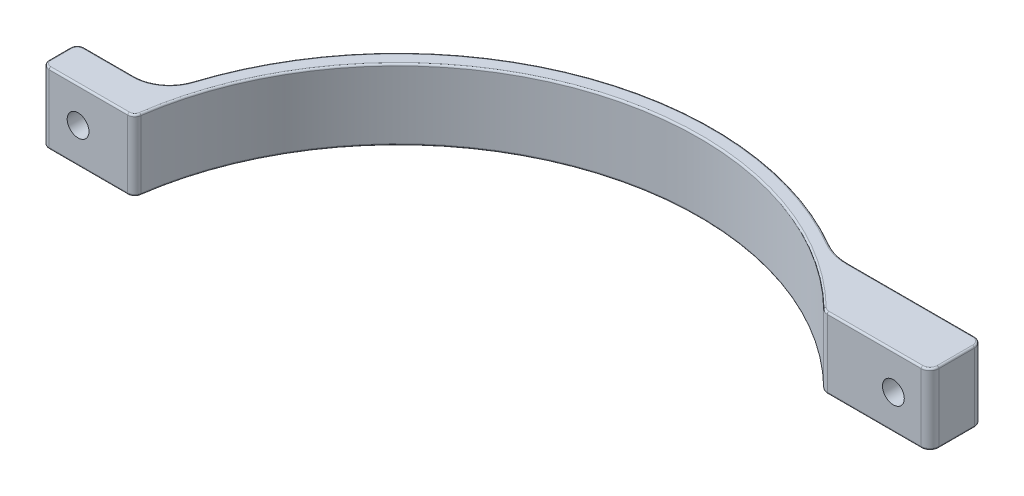
from build123d import *

# Parameters (mm, degrees)
RESSALTO_EXTRUS_O1_DEPTH   = 20
ESBO_O3_R                  = 3.075
CORTE_EXTRUS_O1_DEPTH      = 20
ESBO_O4_R                  = 5.25
CORTE_EXTRUS_O2_DEPTH      = 6
CORTE_EXTRUS_O3_DEPTH      = 138.227202785
CORTE_EXTRUS_O3_DEPTH_BACK = 138.227202785
ESBO_O5_R                  = 3.075
CORTE_EXTRUS_O4_DEPTH      = 5
FILETE1_R                  = 0.5


with BuildPart() as part:
    # Esboço1 → Ressalto-extrusão1 (new body)
    with BuildSketch(Plane(origin=(0, 0, 0), x_dir=(1, 0, 0), z_dir=(0, 1, 0))):
        with BuildLine():
            Line((61.23724357, 60), (87.707972894, 60))
            ThreePointArc((87.707972894, 60), (89.475739847, 60.732233047), (90.207972894, 62.5))
            Line((90.207972894, 62.5), (90.207972894, 72.5))
            ThreePointArc((90.207972894, 72.5), (89.475739847, 74.267766953), (87.707972894, 75))
            Line((87.707972894, 75), (52.115256883, 75))
            ThreePointArc((52.115256883, 75), (48.223697971, 75.513600543), (44.598633294, 77.019230769))
            ThreePointArc((44.598633294, 77.019230769), (-32.102711223, 83.008529273), (-84.815301953, 26.96969697))
            ThreePointArc((-84.815301953, 26.96969697), (-88.441850634, 21.92835115), (-94.345111161, 20))
            Line((-94.345111161, 20), (-108.409715081, 20))
            ThreePointArc((-108.409715081, 20), (-109.823928643, 19.414213562), (-110.409715081, 18))
            Line((-110.409715081, 18), (-110.409715081, 12))
            ThreePointArc((-110.409715081, 12), (-109.823928643, 10.585786438), (-108.409715081, 10))
            Line((-108.409715081, 10), (-86.168439698, 10))
            ThreePointArc((-86.168439698, 10), (-84.855375369, 10.491403941), (-84.187556027, 11.724137931))
            ThreePointArc((-84.187556027, 11.724137931), (-27.432289416, 80.451659382), (59.487608039, 60.714285714))
            ThreePointArc((59.487608039, 60.714285714), (60.292332387, 60.185449751), (61.23724357, 60))
        make_face()
    extrude(amount=RESSALTO_EXTRUS_O1_DEPTH)

    # Esboço3 → Corte-extrusão1 (cut)
    with BuildSketch(Plane.XY.offset(-60)):
        with Locations((79.862425804, 9.799419725)):
            Circle(ESBO_O3_R)
    extrude(amount=-CORTE_EXTRUS_O1_DEPTH, mode=Mode.SUBTRACT)

    # Esboço4 → Corte-extrusão2 (cut)
    with BuildSketch(Plane(origin=(0, 0, -75), x_dir=(-1, 0, 0), z_dir=(0, 0, -1))):
        with Locations((-79.862425804, 9.799419725)):
            Circle(ESBO_O4_R)
    extrude(amount=-CORTE_EXTRUS_O2_DEPTH, mode=Mode.SUBTRACT)

    # Esboço5 → Corte-extrusão3 (cut, two sides: drawn at the far end of the back side and taken through both)
    with BuildSketch(Plane.XY.offset(-10).offset(-CORTE_EXTRUS_O3_DEPTH_BACK)):
        with Locations((-100.179715081, 10)):
            Circle(ESBO_O5_R)
    extrude(amount=CORTE_EXTRUS_O3_DEPTH + CORTE_EXTRUS_O3_DEPTH_BACK, mode=Mode.SUBTRACT)

    # Esboço6 → Corte-extrusão4 (cut)
    with BuildSketch(Plane(origin=(0, 0, -20), x_dir=(-1, 0, 0), z_dir=(0, 0, -1))):
        Polygon((105.204715081, 7.098814897), (105.204715081, 12.901185103), (100.179715081, 15.802370205), (95.154715081, 12.901185103), (95.154715081, 7.098814897), (100.179715081, 4.197629795), align=None)
    extrude(amount=-CORTE_EXTRUS_O4_DEPTH, mode=Mode.SUBTRACT)

    # Filete1
    filete1_edges = [part.edges().sort_by_distance(p)[0] for p in [
        (-32.102711223, 0, -83.008529273),
        (-88.441850634, 0, -21.92835115),
        (-101.377413121, 0, -20),
        (-109.823928643, 0, -19.414213562),
        (-110.409715081, 0, -15),
        (-109.823928643, 0, -10.585786438),
        (-97.289077389, 0, -10),
        (-84.855375369, 0, -10.491403941),
        (-27.432289416, 0, -80.451659382),
        (60.292332387, 0, -60.185449751),
        (74.472608232, 0, -60),
        (89.475739847, 0, -60.732233047),
        (90.207972894, 0, -67.5),
        (89.475739847, 0, -74.267766953),
        (69.911614889, 0, -75),
        (48.223697971, 0, -75.513600543),
        (69.911614889, 20, -75),
        (89.475739847, 20, -74.267766953),
        (90.207972894, 20, -67.5),
        (89.475739847, 20, -60.732233047),
        (74.472608232, 20, -60),
        (60.292332387, 20, -60.185449751),
        (-27.432289416, 20, -80.451659382),
        (-84.855375369, 20, -10.491403941),
        (-97.289077389, 20, -10),
        (-109.823928643, 20, -10.585786438),
        (-110.409715081, 20, -15),
        (-109.823928643, 20, -19.414213562),
        (-101.377413121, 20, -20),
        (-88.441850634, 20, -21.92835115),
        (-32.102711223, 20, -83.008529273),
        (48.223697971, 20, -75.513600543),
    ]]
    fillet(filete1_edges, radius=FILETE1_R)


solid = part.part
